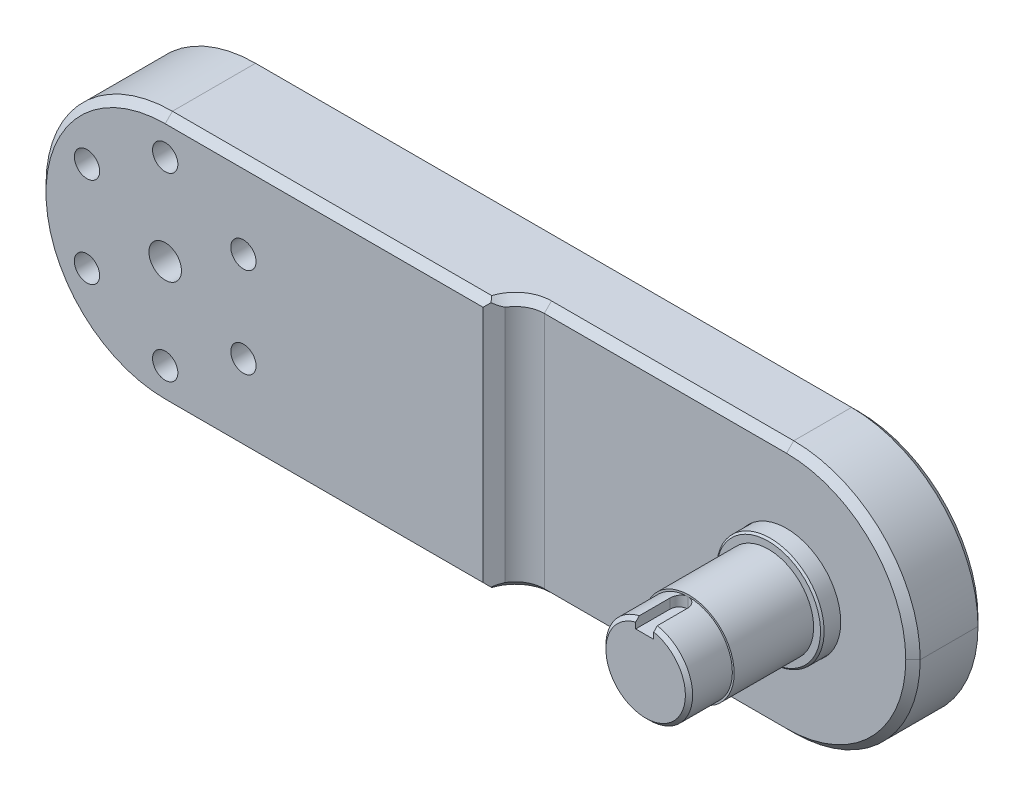
from build123d import *

# Parameters (mm, degrees)
SKETCH_1_R           = 35
EXTRUDE_1_DEPTH      = 27
SKETCH_2_R           = 30
CUT_EXTRUDE_1_DEPTH  = 13
SKETCH_3_R           = 3.5
CUT_EXTRUDE_2_DEPTH  = 18
EXTRUDE_START        = -27
EXTRUDE_3_DEPTH      = 27
SKETCH_6_R           = 4.5
CUT_EXTRUDE_3_DEPTH  = 25
FILLET_2_R           = 35
SKETCH_13_W          = 160
SKETCH_13_H          = 104.985754986
CUT_EXTRUDE_7_DEPTH  = 7
FILLET_4_R           = 8
CHAMFER_1_SIZE       = 2
CHAMFER_2_SIZE       = 2
CHAMFER_3_SIZE       = 2
SKETCH_14_R          = 15
CUT_EXTRUDE_8_DEPTH  = 53
SKETCH_15_R          = 14.9
EXTRUDE_5_DEPTH      = 22
SKETCH_17_R          = 12.5
EXTRUDE_6_DEPTH      = 34
SKETCH_18_R          = 12.5
SKETCH_18_R_2        = 12
CUT_EXTRUDE_9_DEPTH  = 12
CHAMFER_6_SIZE       = 1
CHAMFER_7_SIZE       = 0.5
CUT_EXTRUDE_START    = -3
SKETCH_19_R          = 17.5
SKETCH_19_R_2        = 15
CUT_EXTRUDE_10_DEPTH = 3
SKETCH_20_R          = 17.45
EXTRUDE_7_DEPTH      = 3
SKETCH_21_W          = 5
SKETCH_21_H          = 3
CUT_EXTRUDE_11_DEPTH = 12
FILLET_5_R           = 2.5


# Some blends are built 0.0001 mm under size
with BuildPart() as part:
    # 草图1 → 拉伸1 (new body)
    with BuildSketch(Plane.XY):
        Circle(SKETCH_1_R)
    extrude(amount=EXTRUDE_1_DEPTH)

    # 草图2 → 切除-拉伸1 (cut)
    with BuildSketch(Plane(origin=(0, 0, 0), x_dir=(-1, 0, 0), z_dir=(0, 0, -1))):
        Circle(SKETCH_2_R)
    extrude(amount=-CUT_EXTRUDE_1_DEPTH, mode=Mode.SUBTRACT)

    # 草图3 → 切除-拉伸2 (cut)
    with BuildSketch(Plane(origin=(0, 0, 13), x_dir=(-1, 0, 0), z_dir=(0, 0, -1))):
        with Locations((0, 25)):
            Circle(SKETCH_3_R)
        with Locations((21.650635095, 12.5)):
            Circle(SKETCH_3_R)
        with Locations((21.650635095, -12.5)):
            Circle(SKETCH_3_R)
        with Locations((0, -25)):
            Circle(SKETCH_3_R)
        with Locations((-21.650635095, -12.5)):
            Circle(SKETCH_3_R)
        with Locations((-21.650635095, 12.5)):
            Circle(SKETCH_3_R)
    extrude(amount=-CUT_EXTRUDE_2_DEPTH, mode=Mode.SUBTRACT)

    # 草图5 → 拉伸3 (add)
    with BuildSketch(Plane.XY.offset(27).offset(EXTRUDE_START)):
        with BuildLine():
            Line((0, 35), (150, 35))
            Line((150, 35), (200, 35))
            Line((200, 35), (200, -35))
            Line((200, -35), (150, -35))
            Line((150, -35), (0, -35))
            ThreePointArc((0, -35), (35, 0), (0, 35))
        make_face()
    extrude(amount=EXTRUDE_3_DEPTH)

    # 草图6 → 切除-拉伸3 (cut)
    with BuildSketch(Plane.XY.offset(27)):
        Circle(SKETCH_6_R)
    extrude(amount=-CUT_EXTRUDE_3_DEPTH, mode=Mode.SUBTRACT)

    # 圆角2
    fillet_2_edges = [part.edges().sort_by_distance(p)[0] for p in [
        (200, -35, 13.5),
        (200, 35, 13.5),
    ]]
    fillet(fillet_2_edges, radius=FILLET_2_R - 0.0001)  # a hair under: the kernel refuses the full size

    # 草图13 → 切除-拉伸7 (cut)
    with BuildSketch(Plane.XY.offset(27)):
        with Locations((170, -0.47008547)):
            Rectangle(SKETCH_13_W, SKETCH_13_H)
    extrude(amount=-CUT_EXTRUDE_7_DEPTH, mode=Mode.SUBTRACT)

    # 圆角4
    # the kernel refuses this fillet: 8 mm, written as the material it adds along each edge
    with BuildSketch(Plane(origin=(90, 35, 20), x_dir=(0, 0, 1), z_dir=(0, -1, 0))) as fillet_4_piece_1:
        with BuildLine():
            CenterArc((8, -7.937253933), FILLET_4_R, 97.180755781, 82.819244219)
            Line((0, -7.937253933), (-0.16, -7.937253933))
            Line((-0.16, -7.937253933), (-0.16, 0))
            Line((-0.16, 0), (0, 0.16))
            ThreePointArc((0, 0.16), (3.5, 0.16), (6.98, 0.158745079))
            Line((6.98, 0.158745079), (7, 0))
        make_face()
    extrude(amount=70)

    # 倒角1
    chamfer_1_edges = [part.edges().sort_by_distance(p)[0] for p in [
        (-35, 0, 0),
        (82.50005, -35, 0),
        (82.50005, 35, 0),
        (189.748766631, 24.748766631, 0),
        (189.748766631, -24.748766631, 0),
    ]]
    chamfer(chamfer_1_edges, length=CHAMFER_1_SIZE)

    # 倒角2
    chamfer_2_edges = [part.edges().sort_by_distance(p)[0] for p in [
        (-35, 0, 27),
        (45, -35, 27),
        (189.748766631, -24.748766631, 20),
        (45, 35, 27),
        (189.748766631, 24.748766631, 20),
        (131.468676967, 35, 20),
        (131.468676967, -35, 20),
        (92.645751311, -35, 22),
        (92.645751311, 35, 22),
    ]]
    chamfer(chamfer_2_edges, length=CHAMFER_2_SIZE)

    # 倒角3
    # the kernel refuses this chamfer: 2.306388112, 2 mm, written as the material it takes off along each edge
    with BuildSketch(Plane(origin=(90, 41.181185436, 27), x_dir=(0.3202731013465003, 0, -0.9473252559463905), z_dir=(0, -1, 0))) as chamfer_3_piece_1:
        with BuildLine():
            Line((3.189527355, 0), (-CHAMFER_3_SIZE * 0.320273101347, -CHAMFER_3_SIZE * 0.947325255946))
            Line((-CHAMFER_3_SIZE * 0.320273101347, -CHAMFER_3_SIZE * 0.947325255946), (0, 0))
            ThreePointArc((0, 0), (1.637065861, -0.160453942), (3.189527355, 0))
        make_face()
    extrude(amount=82.362370873, mode=Mode.SUBTRACT)

    # 草图14 → 切除-拉伸8 (cut)
    with BuildSketch(Plane.XY.offset(20)):
        with Locations((165, 0)):
            Circle(SKETCH_14_R)
    extrude(amount=-CUT_EXTRUDE_8_DEPTH, mode=Mode.SUBTRACT)

    # 草图19 → 切除-拉伸10 (cut)
    with BuildSketch(Plane(origin=(0, 0, 0), x_dir=(-1, 0, 0), z_dir=(0, 0, -1)).offset(CUT_EXTRUDE_START)):
        with Locations((-165, 0)):
            Circle(SKETCH_19_R)
        with Locations(Location((-165, 0, 0), (0, 0, 180))):
            Circle(SKETCH_19_R_2, mode=Mode.SUBTRACT)
    extrude(amount=CUT_EXTRUDE_10_DEPTH, mode=Mode.SUBTRACT)

    # 草图20 → 拉伸7 (add)
    with BuildSketch(Plane(origin=(0, 0, 3), x_dir=(-1, 0, 0), z_dir=(0, 0, -1))):
        with Locations((-165, 0)):
            Circle(SKETCH_20_R)
    extrude(amount=EXTRUDE_7_DEPTH)


with BuildPart() as body_2:
    # 草图15 → 拉伸5 (new body)
    with BuildSketch(Plane(origin=(0, 0, 3), x_dir=(-1, 0, 0), z_dir=(0, 0, -1))):
        with Locations((-165, 0)):
            Circle(SKETCH_15_R)
    extrude(amount=-EXTRUDE_5_DEPTH)

    # 草图17 → 拉伸6 (add)
    with BuildSketch(Plane.XY.offset(25)):
        with Locations(Location((165, 0, 0), (0, 0, 180))):
            Circle(SKETCH_17_R)
    extrude(amount=EXTRUDE_6_DEPTH)

    # 草图18 → 切除-拉伸9 (cut)
    with BuildSketch(Plane.XY.offset(59)):
        with Locations(Location((165, 0, 0), (0, 0, 180))):
            Circle(SKETCH_18_R)
        with Locations((165, 0)):
            Circle(SKETCH_18_R_2, mode=Mode.SUBTRACT)
    extrude(amount=-CUT_EXTRUDE_9_DEPTH, mode=Mode.SUBTRACT)

    # 倒角6
    chamfer_6_edges = [body_2.edges().sort_by_distance(p)[0] for p in [
        (153, 0, 59),
    ]]
    chamfer(chamfer_6_edges, length=CHAMFER_6_SIZE)

    # 倒角7
    chamfer_7_edges = [body_2.edges().sort_by_distance(p)[0] for p in [
        (179.9, 0, 25),
    ]]
    chamfer(chamfer_7_edges, length=CHAMFER_7_SIZE)

    # 草图21 → 切除-拉伸11 (cut)
    with BuildSketch(Plane.XY.offset(59)):
        with Locations((164.739676864, 10.5)):
            Rectangle(SKETCH_21_W, SKETCH_21_H)
    extrude(amount=-CUT_EXTRUDE_11_DEPTH, mode=Mode.SUBTRACT)

    # 圆角5
    fillet_5_edges = [body_2.edges().sort_by_distance(p)[0] for p in [
        (167.239676864, 10.394570543, 47),
        (162.239676864, 10.339105586, 47),
    ]]
    fillet(fillet_5_edges, radius=FILLET_5_R - 0.0001)  # a hair under: the kernel refuses the full size


solid = Compound([part.part, body_2.part])
